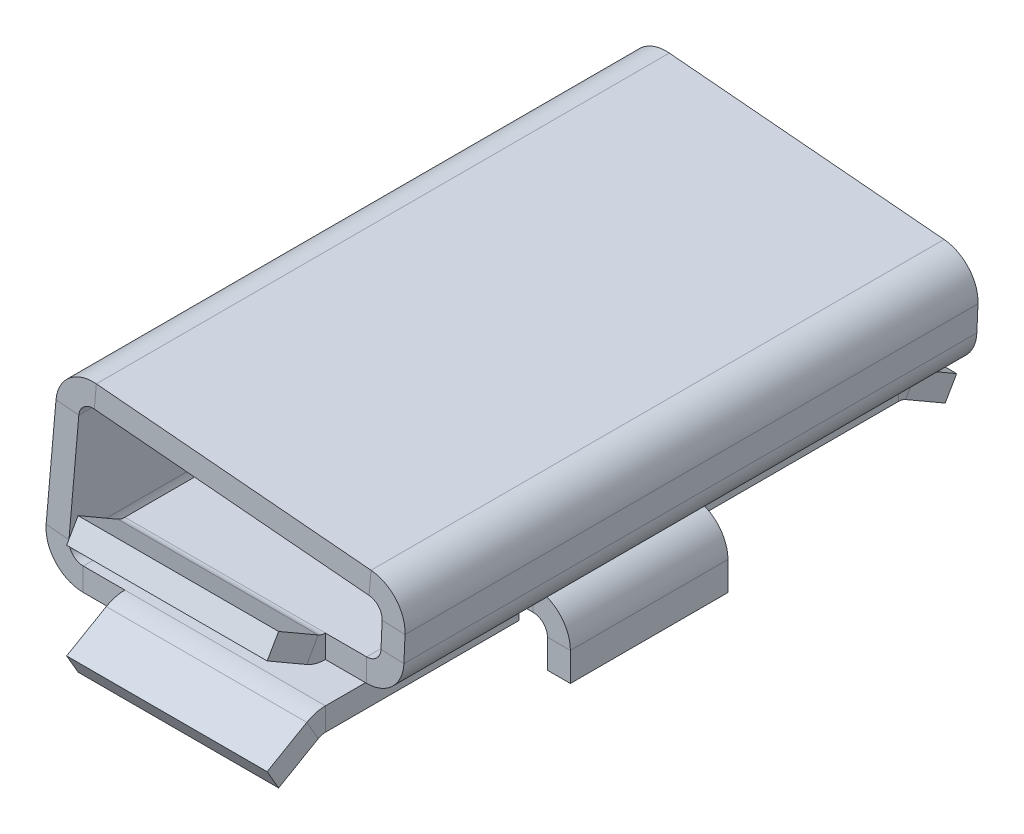
from build123d import *

# Parameters (mm, degrees)
BASE_FLANGE1_DEPTH       = 10
CUT_EXTRUDE1_REACH       = 27.713
MITER_START              = 3.625
MITER_FLANGE1_DEPTH      = 2.75
MITER_START_2            = 18.571970472
MITER_FLANGE4_DEPTH      = 4.220143907
MITER_START_3            = 17.844797598
MITER_FLANGE5_DEPTH      = 4.227172874
CUT_EXTRUDE8_DEPTH       = 0.727172875
CUT_EXTRUDE9_START       = -0.720143907
CUT_EXTRUDE9_DEPTH       = 0.720143907
CUT_EXTRUDE10_DEPTH      = 22.568364065
CUT_EXTRUDE10_DEPTH_BACK = 22.568364065
SKETCH26_W               = 10.008347653
SKETCH26_H               = 5.563663723


# Read off the part's stored shape, not the designer's step: Miter Flange1, Miter Flange4, Miter Flange5
# Sheet-metal steps are written as plain solids
with BuildPart() as part:
    # Sketch1 → Base-Flange1 (new body)
    with BuildSketch(Plane.XY):
        with BuildLine():
            Line((18.571970472, 61.565136218), (22.792114379, 61.565136218))
            ThreePointArc((22.792114379, 61.565136218), (22.964992643, 61.634545227), (23.041876434, 61.804231371))
            Line((23.041876434, 61.804231371), (23.061531352, 62.254403009))
            ThreePointArc((23.061531352, 62.254403009), (22.999729249, 62.43014431), (22.833558233, 62.51435653))
            Line((22.833558233, 62.51435653), (18.038908504, 62.933834027))
            ThreePointArc((18.038908504, 62.933834027), (17.856422666, 62.876296464), (17.768070893, 62.706574288))
            Line((17.768070893, 62.706574288), (17.595748923, 60.736925153))
            ThreePointArc((17.595748923, 60.736925153), (17.660478263, 60.546238666), (17.844797598, 60.465136218))
            Line((17.844797598, 60.465136218), (22.071970472, 60.465136218))
            Line((22.071970472, 60.465136218), (22.071970472, 60.065136218))
            Line((22.071970472, 60.065136218), (17.844797598, 60.065136218))
            ThreePointArc((17.844797598, 60.065136218), (17.365567329, 60.276002583), (17.197271044, 60.771787451))
            Line((17.197271044, 60.771787451), (17.369593014, 62.741436586))
            ThreePointArc((17.369593014, 62.741436586), (17.599307622, 63.182714241), (18.073770801, 63.332311907))
            Line((18.073770801, 63.332311907), (22.86842053, 62.91283441))
            ThreePointArc((22.86842053, 62.91283441), (23.300465172, 62.693882636), (23.461150641, 62.236955254))
            Line((23.461150641, 62.236955254), (23.441495723, 61.786783616))
            ThreePointArc((23.441495723, 61.786783616), (23.241597865, 61.345599642), (22.792114379, 61.165136218))
            Line((22.792114379, 61.165136218), (18.571970472, 61.165136218))
            Line((18.571970472, 61.165136218), (18.571970472, 61.565136218))
        make_face()
    extrude(amount=BASE_FLANGE1_DEPTH)

    # Sketch7 → Cut-Extrude1 (cut, up to next)
    with BuildSketch(Plane.XZ.offset(-60.065136218), mode=Mode.PRIVATE) as cut_extrude1_sk1:
        with BuildLine():
            Line((22.071970472, 3.375), (21.821970472, 3.375))
            ThreePointArc((21.821970472, 3.375), (21.696970472, 3.5), (21.821970472, 3.625))
            Line((21.821970472, 3.625), (22.071970472, 3.625))
            ThreePointArc((22.071970472, 3.625), (22.196970472, 3.5), (22.071970472, 3.375))
        make_face()
    cut_extrude1_tool1 = extrude(cut_extrude1_sk1.sketch, amount=-CUT_EXTRUDE1_REACH, mode=Mode.PRIVATE) & part.part
    # Sketch7 → Cut-Extrude1 (cut, up to next)
    with BuildSketch(Plane.XZ.offset(-60.065136218), mode=Mode.PRIVATE) as cut_extrude1_sk2:
        with BuildLine():
            Line((22.071970472, 6.375), (21.821970472, 6.375))
            ThreePointArc((21.821970472, 6.375), (21.696970472, 6.5), (21.821970472, 6.625))
            Line((21.821970472, 6.625), (22.071970472, 6.625))
            ThreePointArc((22.071970472, 6.625), (22.196970472, 6.5), (22.071970472, 6.375))
        make_face()
    cut_extrude1_tool2 = extrude(cut_extrude1_sk2.sketch, amount=-CUT_EXTRUDE1_REACH, mode=Mode.PRIVATE) & part.part
    add(cut_extrude1_tool1.solids().sort_by_distance((21.94697, 60.065136, 3.5))[0], mode=Mode.SUBTRACT)
    add(cut_extrude1_tool2.solids().sort_by_distance((21.94697, 60.065136, 6.5))[0], mode=Mode.SUBTRACT)

    # Miter Flange1 outline → Miter Flange1 (add)
    with BuildSketch(Plane.XY.offset(MITER_START)):
        with BuildLine():
            Line((22.321970472, 59.315136218), (22.721970472, 59.315136218))
            Line((22.721970472, 59.315136218), (22.721970472, 59.815136218))
            ThreePointArc((22.721970472, 59.815136218), (22.53158988, 60.274755626), (22.071970472, 60.465136218))
            Line((22.071970472, 60.465136218), (22.071970472, 60.065136218))
            ThreePointArc((22.071970472, 60.065136218), (22.248747167, 59.991912914), (22.321970472, 59.815136218))
            Line((22.321970472, 59.815136218), (22.321970472, 59.315136218))
        make_face()
    extrude(amount=MITER_FLANGE1_DEPTH)

    # Miter Flange4 outline → Miter Flange4 (add)
    with BuildSketch(Plane.YZ.offset(MITER_START_2)):
        with BuildLine():
            Line((61.99814892, 10.816987298), (61.651738758, 11.016987298))
            Line((61.651738758, 11.016987298), (61.252219705, 10.325))
            ThreePointArc((61.252219705, 10.325), (61.187284431, 10.168232379), (61.165136218, 10))
            Line((61.165136218, 10), (61.565136218, 10))
            ThreePointArc((61.565136218, 10), (61.573654761, 10.064704761), (61.598629867, 10.125))
            Line((61.598629867, 10.125), (61.99814892, 10.816987298))
        make_face()
    extrude(amount=MITER_FLANGE4_DEPTH)

    # Miter Flange5 outline → Miter Flange5 (add)
    with BuildSketch(Plane.YZ.offset(MITER_START_3)):
        with BuildLine():
            Line((59.978533677, 11.016987298), (59.632123516, 10.816987298))
            Line((59.632123516, 10.816987298), (60.031642569, 10.125))
            ThreePointArc((60.031642569, 10.125), (60.056617674, 10.064704761), (60.065136218, 10))
            Line((60.065136218, 10), (60.465136218, 10))
            ThreePointArc((60.465136218, 10), (60.442988005, 10.168232379), (60.37805273, 10.325))
            Line((60.37805273, 10.325), (59.978533677, 11.016987298))
        make_face()
    extrude(amount=MITER_FLANGE5_DEPTH)

    # Sketch20 → Cut-Extrude8 (cut)
    with BuildSketch(Plane.ZY.offset(-17.844797598)):
        with BuildLine():
            Line((10.125, 60.031642569), (10.816987298, 59.632123516))
            Line((10.816987298, 59.632123516), (11.016987298, 59.978533677))
            Line((11.016987298, 59.978533677), (10.325, 60.37805273))
            ThreePointArc((10.325, 60.37805273), (10.168232379, 60.442988005), (10, 60.465136218))
            Line((10, 60.465136218), (10, 60.065136218))
            ThreePointArc((10, 60.065136218), (10.064704761, 60.056617674), (10.125, 60.031642569))
        make_face()
    extrude(amount=-CUT_EXTRUDE8_DEPTH, mode=Mode.SUBTRACT)

    # Sketch23 → Cut-Extrude9 (cut)
    with BuildSketch(Plane(origin=(22.792114379, 0, 0), x_dir=(0, 0, -1), z_dir=(1, 0, 0)).offset(CUT_EXTRUDE9_START)):
        with BuildLine():
            Line((-10.125, 61.598629867), (-10.816987298, 61.99814892))
            Line((-10.816987298, 61.99814892), (-11.016987298, 61.651738758))
            Line((-11.016987298, 61.651738758), (-10.325, 61.252219705))
            ThreePointArc((-10.325, 61.252219705), (-10.168232379, 61.187284431), (-10, 61.165136218))
            Line((-10, 61.165136218), (-10, 61.565136218))
            ThreePointArc((-10, 61.565136218), (-10.064704761, 61.573654761), (-10.125, 61.598629867))
        make_face()
    extrude(amount=CUT_EXTRUDE9_DEPTH, mode=Mode.SUBTRACT)

    # Sketch26 → Cut-Extrude10 (cut, two sides: drawn at the far end of the back side and taken through both)
    with BuildSketch(Plane(origin=(5.63606087, 64.420470526, 0), x_dir=(0.9961946980917451, -0.08715574274766313, 0), z_dir=(0.08715574274766313, 0.9961946980917451, 0)).offset(-CUT_EXTRUDE10_DEPTH_BACK)):
        with Locations((14.807454486, -2.218168138)):
            Rectangle(SKETCH26_W, SKETCH26_H)
    extrude(amount=CUT_EXTRUDE10_DEPTH + CUT_EXTRUDE10_DEPTH_BACK, mode=Mode.SUBTRACT)

    # Mirror1: part across plane


with BuildPart() as part_1:
    add(part.part)
    add(part.part.mirror(Plane(origin=(25.016835548, 58.630796571, 5), x_dir=(1, 0, 0), z_dir=(0, 0, 1))))


solid = part_1.part
